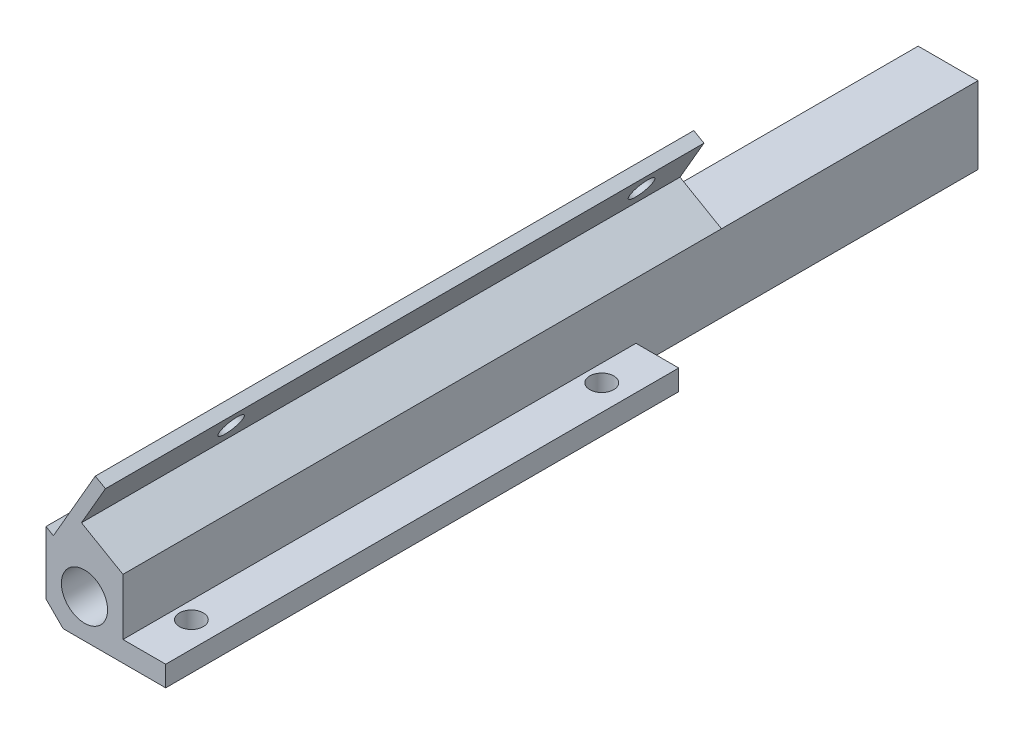
from build123d import *

# Parameters (mm, degrees)
SKETCH1_W           = 77.47
SKETCH1_H           = 127
BOSS_EXTRUDE1_DEPTH = 11.43
SKETCH2_R           = 3.429
CUT_EXTRUDE1_DEPTH  = 150.202030147
CUT_EXTRUDE2_DEPTH  = 150.202030147
SKETCH4_W           = 54.61
SKETCH4_H           = 6.35
CUT_EXTRUDE3_DEPTH  = 150.202030147
CHAMFER1_SIZE       = 2.54
CUT_EXTRUDE4_DEPTH  = 150.202030147
SKETCH6_W           = 53.34
SKETCH6_H           = 76.2
CUT_EXTRUDE5_DEPTH  = 150.202030147
SKETCH7_R           = 1.778
HOLE_CUTS_1_DEPTH   = 130.427892666
BOSS_EXTRUDE5_DEPTH = 88.9
SKETCH18_W          = 6.35
SKETCH18_H          = 5.08
CUT_EXTRUDE13_DEPTH = 76.2
HOLE_CUTS_2_REACH   = 132.131
SKETCH19_R          = 1.778
SKETCH20_W          = 88.9
SKETCH20_H          = 11.176
CUT_EXTRUDE16_DEPTH = 1.27
SKETCH21_W          = 88.9
SKETCH21_H          = 5.842
CUT_EXTRUDE17_DEPTH = 0.762
SKETCH22_W          = 6.35
SKETCH22_H          = 76.2
CUT_EXTRUDE18_DEPTH = 2.032
SKETCH23_W          = 1.736640818
SKETCH23_H          = 88.9
BOSS_EXTRUDE6_DEPTH = 1.27


with BuildPart() as part:
    # Sketch1 → Boss-Extrude1 (new body)
    with BuildSketch(Plane(origin=(0, 0, 0), x_dir=(1, 0, 0), z_dir=(0, 1, 0))):
        with Locations((38.735, 63.5)):
            Rectangle(SKETCH1_W, SKETCH1_H)
    extrude(amount=BOSS_EXTRUDE1_DEPTH)

    # Sketch2 → Cut-Extrude1 (cut, through all)
    with BuildSketch(Plane.XY):
        with Locations((5.715, 5.715)):
            Circle(SKETCH2_R)
        with Locations((71.755, 5.715)):
            Circle(SKETCH2_R)
    extrude(amount=-CUT_EXTRUDE1_DEPTH, mode=Mode.SUBTRACT)

    # Sketch3 → Cut-Extrude2 (cut, through all)
    with BuildSketch(Plane(origin=(0, 11.43, 0), x_dir=(1, 0, 0), z_dir=(0, 1, 0))):
        with BuildLine():
            Line((11.43, 127), (11.43, 88.9))
            ThreePointArc((11.43, 88.9), (15.149743879, 79.919743879), (24.13, 76.2))
            Line((24.13, 76.2), (53.34, 76.2))
            ThreePointArc((53.34, 76.2), (62.320256121, 79.919743879), (66.04, 88.9))
            Line((66.04, 88.9), (66.04, 127))
            Line((66.04, 127), (11.43, 127))
        make_face()
    extrude(amount=-CUT_EXTRUDE2_DEPTH, mode=Mode.SUBTRACT)

    # Sketch4 → Cut-Extrude3 (cut, through all)
    with BuildSketch(Plane(origin=(0, 0, -127), x_dir=(-1, 0, 0), z_dir=(0, 0, -1))):
        with Locations((-38.735, 8.255)):
            Rectangle(SKETCH4_W, SKETCH4_H)
    extrude(amount=-CUT_EXTRUDE3_DEPTH, mode=Mode.SUBTRACT)

    # Chamfer1
    chamfer1_edges = [part.edges().sort_by_distance(p)[0] for p in [
        (0, 0, -63.5),
        (0, 11.43, -63.5),
        (77.47, 0, -63.5),
        (77.47, 11.43, -63.5),
    ]]
    chamfer(chamfer1_edges, length=CHAMFER1_SIZE)

    # Sketch5 → Cut-Extrude4 (cut, through all)
    with BuildSketch(Plane(origin=(0, 11.43, 0), x_dir=(1, 0, 0), z_dir=(0, 1, 0))):
        Polygon((11.43, 88.9), (11.43, 76.2), (77.47, 76.2), (77.47, 127), (11.43, 127), align=None)
    extrude(amount=-CUT_EXTRUDE4_DEPTH, mode=Mode.SUBTRACT)

    # Sketch6 → Cut-Extrude5 (cut, through all)
    with BuildSketch(Plane(origin=(0, 11.43, 0), x_dir=(1, 0, 0), z_dir=(0, 1, 0))):
        with Locations((50.8, 38.1)):
            Rectangle(SKETCH6_W, SKETCH6_H)
    extrude(amount=-CUT_EXTRUDE5_DEPTH, mode=Mode.SUBTRACT)

    # Sketch7 → Hole Cuts 1 (cut, through all)
    with BuildSketch(Plane(origin=(0, 5.08, 0), x_dir=(1, 0, 0), z_dir=(0, 1, 0))):
        with Locations((13.97, 68.58)):
            Circle(SKETCH7_R)
        with Locations((13.97, 7.62)):
            Circle(SKETCH7_R)
    extrude(amount=-HOLE_CUTS_1_DEPTH, mode=Mode.SUBTRACT)

    # Sketch17 → Boss-Extrude5 (add)
    with BuildSketch(Plane.XY):
        Polygon((0, 8.89), (0, 11.869940905), (5.588, 21.548640818), (8.851738686, 19.664320409), (5.930738686, 14.605), (11.43, 11.43), (2.54, 11.43), align=None)
    extrude(amount=-BOSS_EXTRUDE5_DEPTH)

    # Sketch18 → Cut-Extrude13 (cut)
    with BuildSketch(Plane.XY):
        with Locations((20.955, 2.54)):
            Rectangle(SKETCH18_W, SKETCH18_H)
    extrude(amount=-CUT_EXTRUDE13_DEPTH, mode=Mode.SUBTRACT)

    # Sketch19 → Hole Cuts 2 (cut, up to next)
    with BuildSketch(Plane(origin=(-1.876096497, 1.083164817, 0), x_dir=(0, 0, -1), z_dir=(0.8660254037844362, -0.5000000000000042, 0)), mode=Mode.PRIVATE) as hole_cuts_2_sk1:
        with Locations((20.32, 19.423670365)):
            Circle(SKETCH19_R)
    hole_cuts_2_tool1 = extrude(hole_cuts_2_sk1.sketch, amount=-HOLE_CUTS_2_REACH, mode=Mode.PRIVATE) & part.part
    # Sketch19 → Hole Cuts 2 (cut, up to next)
    with BuildSketch(Plane(origin=(-1.876096497, 1.083164817, 0), x_dir=(0, 0, -1), z_dir=(0.8660254037844362, -0.5000000000000042, 0)), mode=Mode.PRIVATE) as hole_cuts_2_sk2:
        with Locations((81.28, 19.423670365)):
            Circle(SKETCH19_R)
    hole_cuts_2_tool2 = extrude(hole_cuts_2_sk2.sketch, amount=-HOLE_CUTS_2_REACH, mode=Mode.PRIVATE) & part.part
    add(hole_cuts_2_tool1.solids().sort_by_distance((7.835739, 17.904557, -20.32))[0], mode=Mode.SUBTRACT)
    add(hole_cuts_2_tool2.solids().sort_by_distance((7.835739, 17.904557, -81.28))[0], mode=Mode.SUBTRACT)

    # Sketch20 → Cut-Extrude16 (cut)
    with BuildSketch(Plane(origin=(-5.139835183, 2.967485226, 0), x_dir=(0, 0, 1), z_dir=(-0.8660254037844362, 0.5000000000000042, 0))):
        with Locations((-44.45, 15.867670365)):
            Rectangle(SKETCH20_W, SKETCH20_H)
    extrude(amount=-CUT_EXTRUDE16_DEPTH, mode=Mode.SUBTRACT)

    # Sketch21 → Cut-Extrude17 (cut)
    with BuildSketch(Plane(origin=(-1.876096497, 1.083164817, 0), x_dir=(0, 0, -1), z_dir=(0.8660254037844366, -0.5000000000000037, 0))):
        with Locations((44.45, 18.534670365)):
            Rectangle(SKETCH21_W, SKETCH21_H)
    extrude(amount=-CUT_EXTRUDE17_DEPTH, mode=Mode.SUBTRACT)

    # Sketch22 → Cut-Extrude18 (cut)
    with BuildSketch(Plane(origin=(0, 5.08, 0), x_dir=(1, 0, 0), z_dir=(0, 1, 0))):
        with Locations((14.605, 38.1)):
            Rectangle(SKETCH22_W, SKETCH22_H)
    extrude(amount=-CUT_EXTRUDE18_DEPTH, mode=Mode.SUBTRACT)

    # Sketch23 → Boss-Extrude6 (add)
    with BuildSketch(Plane(origin=(10.727835183, 18.581155592, 0), x_dir=(0.8660254037844366, -0.5000000000000037, 0), z_dir=(0.5000000000000036, 0.8660254037844365, 0))):
        with Locations((-3.796650044, 44.45)):
            Rectangle(SKETCH23_W, SKETCH23_H)
    extrude(amount=BOSS_EXTRUDE6_DEPTH)


solid = part.part
